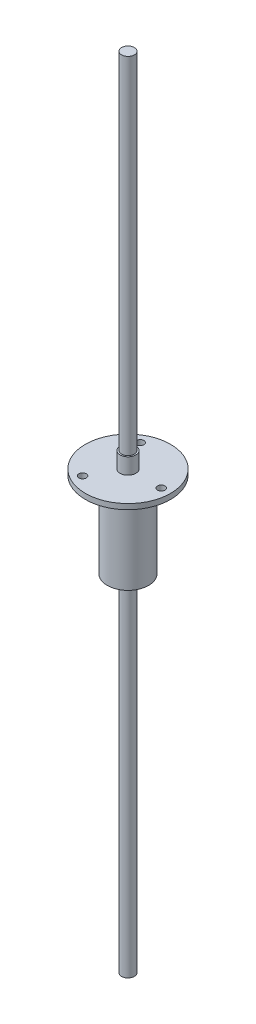
from build123d import *

# Parameters (mm, degrees)
CUT_EXTRUDE1_DEPTH      = 41.924442574
CUT_EXTRUDE1_DEPTH_BACK = 41.924442574
SKETCH2_R               = 1.4
SKETCH3_R               = 2.4
BOSS_EXTRUDE1_DEPTH     = 150


with BuildPart() as part:
    # Sketch1 → Revolve1 (revolve)
    with BuildSketch(Plane(origin=(0, 0, 0), x_dir=(0, 0, -1), z_dir=(1, 0, 0))):
        Polygon((0, 20.05), (2.95, 20.05), (2.95, 14.05), (16, 14.05), (16, 12.05), (7.75, 12.05), (7.75, -20.05), (0, -20.05), align=None)
    revolve(axis=Axis((0, 23.931122449, 0), (0, -1, 0)))

    # Sketch2 → Cut-Extrude1 (cut, two sides: drawn at the far end of the back side and taken through both)
    with BuildSketch(Plane(origin=(0, 14.05, 0), x_dir=(1, 0, 0), z_dir=(0, 1, 0)).offset(-CUT_EXTRUDE1_DEPTH_BACK)):
        with Locations((12.5, 0)):
            Circle(SKETCH2_R)
        with Locations((-6.25, -10.825317547)):
            Circle(SKETCH2_R)
        with Locations((-6.25, 10.825317547)):
            Circle(SKETCH2_R)
    extrude(amount=CUT_EXTRUDE1_DEPTH + CUT_EXTRUDE1_DEPTH_BACK, mode=Mode.SUBTRACT)

    # Sketch3 → Boss-Extrude1 (add, symmetric)
    with BuildSketch(Plane(origin=(0, 0, 0), x_dir=(1, 0, 0), z_dir=(0, 1, 0))):
        Circle(SKETCH3_R)
    extrude(amount=BOSS_EXTRUDE1_DEPTH, both=True)


with BuildPart() as body_2:
    # Split1: the piece on the far side of the plane
    add(part.part)
    split(bisect_by=Plane(origin=(0, 14.05, -2.95), x_dir=(0, 0, -1), z_dir=(0, -1, 0)), keep=Keep.BOTTOM)


with BuildPart() as part_1:
    add(part.part)

    # Split1
    split(bisect_by=Plane(origin=(0, 14.05, -2.95), x_dir=(0, 0, -1), z_dir=(0, -1, 0)), keep=Keep.TOP)


solid = Compound([body_2.part, part_1.part])
